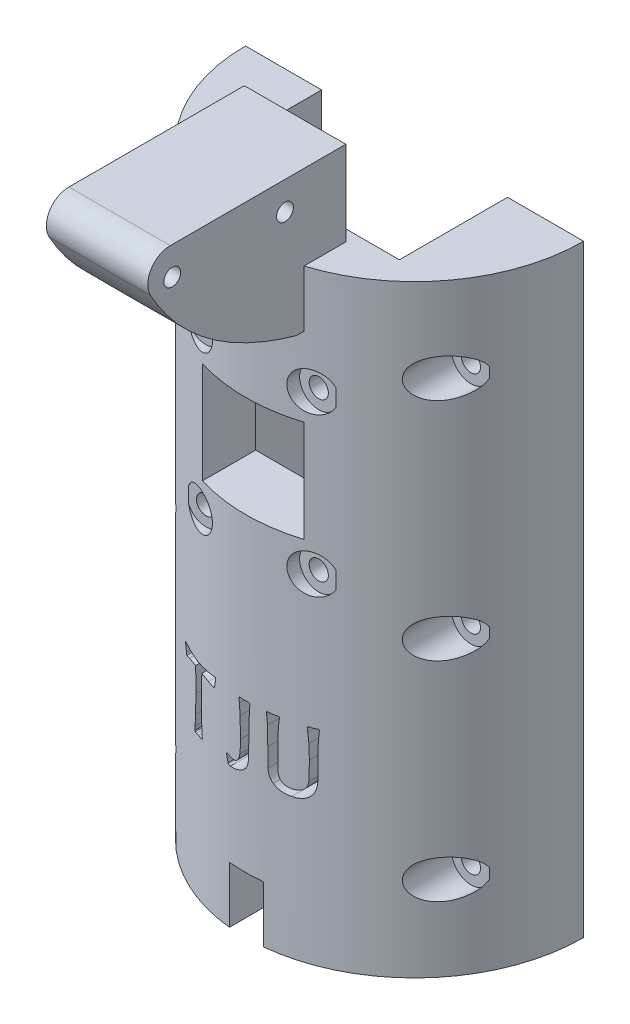
from build123d import *
from build123d.topology import SkipClean

# Parameters (mm, degrees)
EXTRUDE_1_DEPTH      = 80
SKETCH_2_R           = 1.7
CUT_EXTRUDE_1_DEPTH  = 100
SKETCH_3_R           = 1.7
CUT_EXTRUDE_2_DEPTH  = 100
SKETCH_4_R           = 3.4
CUT_EXTRUDE_3_DEPTH  = 26.5
SKETCH_5_R           = 3.4
CUT_EXTRUDE_4_DEPTH  = 13
EXTRUDE_START        = 3
EXTRUDE_2_DEPTH      = 3
EXTRUDE_4_DEPTH      = 9
SKETCH_14_R          = 1.5
CUT_EXTRUDE_6_DEPTH  = 18
SKETCH_18_W          = 18
SKETCH_18_H          = 2
CUT_EXTRUDE_9_DEPTH  = 20
SKETCH_25_W          = 18
SKETCH_25_H          = 38.8
CUT_EXTRUDE_16_DEPTH = 5
FILLET_6_R           = 4
EXTRUDE_START_2      = 19
EXTRUDE_7_DEPTH      = 19
CUT_EXTRUDE_17_REACH = 116.45
SKETCH_29_W          = 30
SKETCH_29_H          = 19.2
EXTRUDE_START_3      = 5
EXTRUDE_9_DEPTH      = 5
SKETCH_31_R          = 3
CUT_EXTRUDE_18_DEPTH = 3
FILLET_7_R           = 1
CHAMFER_3_SIZE       = 2
SKETCH_32_W          = 19.2
SKETCH_32_H          = 102
CUT_EXTRUDE_19_DEPTH = 1.5
SKETCH_33_W          = 19.2
SKETCH_33_H          = 102
CUT_EXTRUDE_20_DEPTH = 1.5
EXTRUDE_10_DEPTH     = 9.5
SKETCH_35_R          = 5
CUT_EXTRUDE_21_DEPTH = 15
SKETCH_36_W          = 6
SKETCH_36_H          = 10
CUT_EXTRUDE_22_DEPTH = 15
SKETCH_39_R          = 1.7
CUT_EXTRUDE_23_DEPTH = 115.450354124
SKETCH_40_R          = 3.4
CUT_EXTRUDE_25_DEPTH = 26.5
SKETCH_41_W          = 18
SKETCH_41_H          = 18
CUT_EXTRUDE_26_DEPTH = 108.354552922
CUT_EXTRUDE_27_DEPTH = 108.354552922


with BuildPart() as part:
    # 草图1 → 凸台-拉伸1 (new body)
    with BuildSketch(Plane(origin=(0, 0, 0), x_dir=(1, 0, 0), z_dir=(0, 1, 0))):
        with BuildLine():
            Line((-15, 0), (-30, 0))
            ThreePointArc((-30, 0), (0, -30), (30, 0))
            Line((30, 0), (15, 0))
            Line((15, 0), (15, -19.2))
            Line((15, -19.2), (-15, -19.2))
            Line((-15, -19.2), (-15, 0))
        make_face()
    extrude(amount=EXTRUDE_1_DEPTH)

    # 草图2 → 切除-拉伸1 (cut)
    with BuildSketch(Plane.XY):
        with Locations(Location((-10, 33, 0), (0, 0, 180))):
            Circle(SKETCH_2_R)
        with Locations(Location((-10, 61, 0), (0, 0, 180))):
            Circle(SKETCH_2_R)
        with Locations(Location((10, 33, 0), (0, 0, 180))):
            Circle(SKETCH_2_R)
        with Locations(Location((10, 61, 0), (0, 0, 180))):
            Circle(SKETCH_2_R)
    extrude(amount=CUT_EXTRUDE_1_DEPTH, mode=Mode.SUBTRACT)

    # 草图3 → 切除-拉伸2 (cut)
    with BuildSketch(Plane(origin=(0, 0, 0), x_dir=(-1, 0, 0), z_dir=(0, 0, -1))):
        with Locations((23.5, 65)):
            Circle(SKETCH_3_R)
        with Locations((-23.5, 65)):
            Circle(SKETCH_3_R)
        with Locations((23.5, 25)):
            Circle(SKETCH_3_R)
        with Locations((-23.5, 25)):
            Circle(SKETCH_3_R)
    extrude(amount=-CUT_EXTRUDE_2_DEPTH, mode=Mode.SUBTRACT)

    # 草图4 → 切除-拉伸3 (cut)
    with BuildSketch(Plane(origin=(0, 0, 40), x_dir=(-1, 0, 0), z_dir=(0, 0, -1))):
        with Locations((-23.5, 65)):
            Circle(SKETCH_4_R)
        with Locations((-23.5, 25)):
            Circle(SKETCH_4_R)
        with Locations((23.5, 65)):
            Circle(SKETCH_4_R)
        with Locations((23.5, 25)):
            Circle(SKETCH_4_R)
    extrude(amount=CUT_EXTRUDE_3_DEPTH, mode=Mode.SUBTRACT)

    # 草图5 → 切除-拉伸4 (cut)
    with BuildSketch(Plane(origin=(0, 0, 40), x_dir=(-1, 0, 0), z_dir=(0, 0, -1))):
        with Locations((-10, 33)):
            Circle(SKETCH_5_R)
        with Locations((10, 33)):
            Circle(SKETCH_5_R)
        with Locations((10, 61)):
            Circle(SKETCH_5_R)
        with Locations((-10, 61)):
            Circle(SKETCH_5_R)
    extrude(amount=CUT_EXTRUDE_4_DEPTH, mode=Mode.SUBTRACT)

    # 草图6 → 凸台-拉伸2 (add)
    with SkipClean():  # the faces are left unmerged after this step: merging them gives an invalid solid
        with BuildSketch(Plane.XZ.offset(EXTRUDE_START)):
            with BuildLine():
                Line((-30, 0), (30, 0))
                ThreePointArc((30, 0), (0, 30), (-30, 0))
            make_face()
        extrude(amount=-EXTRUDE_2_DEPTH)

    # 草图13 → 凸台-拉伸4 (add, symmetric)
    with SkipClean():  # the faces are left unmerged after this step: merging them gives an invalid solid
        with BuildSketch(Plane(origin=(0, 0, 0), x_dir=(0, 0, -1), z_dir=(1, 0, 0))):
            with BuildLine():
                Line((-19.2, 100), (-60, 100))
                add(Edge.make_bspline(
                    [(-60, 100), (-54.458111129, 76.859605584), (-30, 70)],
                    knots=[0, 0, 0, 1, 1, 1], degree=2))
                Line((-30, 70), (-19.2, 70))
                Line((-19.2, 70), (-19.2, 100))
            make_face()
        extrude(amount=EXTRUDE_4_DEPTH, both=True)

    # 草图14 → 切除-拉伸6 (cut)
    with SkipClean():  # the faces are left unmerged after this step: merging them gives an invalid solid
        with BuildSketch(Plane.ZY.offset(9)):
            with Locations((32, 90)):
                Circle(SKETCH_14_R)
            with Locations((52, 90)):
                Circle(SKETCH_14_R)
        extrude(amount=-CUT_EXTRUDE_6_DEPTH, mode=Mode.SUBTRACT)

    # 草图18 → 切除-拉伸9 (cut)
    with SkipClean():  # the faces are left unmerged after this step: merging them gives an invalid solid
        with BuildSketch(Plane(origin=(0, 100, 0), x_dir=(1, 0, 0), z_dir=(0, 1, 0))):
            with Locations((0, -20.2)):
                Rectangle(SKETCH_18_W, SKETCH_18_H)
        extrude(amount=-CUT_EXTRUDE_9_DEPTH, mode=Mode.SUBTRACT)

    # 草图25 → 切除-拉伸16 (cut)
    with SkipClean():  # the faces are left unmerged after this step: merging them gives an invalid solid
        with BuildSketch(Plane(origin=(0, 100, 0), x_dir=(1, 0, 0), z_dir=(0, 1, 0))):
            with Locations((0, -40.6)):
                Rectangle(SKETCH_25_W, SKETCH_25_H)
        extrude(amount=-CUT_EXTRUDE_16_DEPTH, mode=Mode.SUBTRACT)

    # 圆角6
    fillet_6_edges = [part.edges().sort_by_distance(p)[0] for p in [
        (4.4999997, 95, 58.513859135),
    ]]
    fillet(fillet_6_edges, radius=FILLET_6_R)

    # 草图28 → 凸台-拉伸7 (add)
    with SkipClean():  # the faces are left unmerged after this step: merging them gives an invalid solid
        with BuildSketch(Plane.XZ.offset(3).offset(EXTRUDE_START_2)):
            with BuildLine():
                Line((-30, 0), (30, 0))
                ThreePointArc((30, 0), (0, 30), (-30, 0))
            make_face()
        extrude(amount=-EXTRUDE_7_DEPTH)

    # 草图29 → 切除-拉伸17 (cut, up to next)
    with BuildSketch(Plane(origin=(0, 0, 0), x_dir=(1, 0, 0), z_dir=(0, 1, 0)), mode=Mode.PRIVATE) as cut_extrude_17_sk1:
        with Locations((0, -9.6)):
            Rectangle(SKETCH_29_W, SKETCH_29_H)
    cut_extrude_17_tool1 = extrude(cut_extrude_17_sk1.sketch, amount=-CUT_EXTRUDE_17_REACH, mode=Mode.PRIVATE) & part.part
    add(cut_extrude_17_tool1.solids().sort_by_distance((0, 0, 9.6))[0], mode=Mode.SUBTRACT)

    # 草图30 → 凸台-拉伸9 (add)
    with SkipClean():  # the faces are left unmerged after this step: merging them gives an invalid solid
        with BuildSketch(Plane.XZ.offset(22).offset(EXTRUDE_START_3)):
            with BuildLine():
                Line((30, 0), (-30, 0))
                ThreePointArc((-30, 0), (0, 30), (30, 0))
            make_face()
        extrude(amount=-EXTRUDE_9_DEPTH)

    # 草图31 → 切除-拉伸18 (cut)
    with SkipClean():  # the faces are left unmerged after this step: merging them gives an invalid solid
        with BuildSketch(Plane(origin=(0, -22, 0), x_dir=(1, 0, 0), z_dir=(0, 1, 0))):
            Circle(SKETCH_31_R)
        extrude(amount=-CUT_EXTRUDE_18_DEPTH, mode=Mode.SUBTRACT)

    # 圆角7
    fillet_7_edges = [part.edges().sort_by_distance(p)[0] for p in [
        (0, -25, 3),
    ]]
    fillet(fillet_7_edges, radius=FILLET_7_R)

    # 倒角3
    chamfer_3_edges = [part.edges().sort_by_distance(p)[0] for p in [
        (0, -22, 3),
    ]]
    chamfer(chamfer_3_edges, length=CHAMFER_3_SIZE - 0.0001)  # a hair under: the kernel refuses the full size

    # 草图32 → 切除-拉伸19 (cut)
    with BuildSketch(Plane.ZY.offset(-15)):
        with Locations((9.6, 29)):
            Rectangle(SKETCH_32_W, SKETCH_32_H)
    extrude(amount=-CUT_EXTRUDE_19_DEPTH, mode=Mode.SUBTRACT)

    # 草图33 → 切除-拉伸20 (cut)
    with BuildSketch(Plane(origin=(-15, 0, 0), x_dir=(0, 0, -1), z_dir=(1, 0, 0))):
        with Locations((-9.6, 29)):
            Rectangle(SKETCH_33_W, SKETCH_33_H)
    extrude(amount=-CUT_EXTRUDE_20_DEPTH, mode=Mode.SUBTRACT)

    # 草图34 → 凸台-拉伸10 (add)
    with BuildSketch(Plane.XZ.offset(27)):
        with BuildLine():
            Line((-6, 0), (6, 0))
            ThreePointArc((6, 0), (0, 6), (-6, 0))
        make_face()
    extrude(amount=EXTRUDE_10_DEPTH)

    # 草图35 → 切除-拉伸21 (cut)
    with BuildSketch(Plane.XZ.offset(27)):
        with Locations(Location((0, 18.5, 0), (0, 0, 270))):
            Circle(SKETCH_35_R)
    extrude(amount=-CUT_EXTRUDE_21_DEPTH, mode=Mode.SUBTRACT)

    # 草图36 → 切除-拉伸22 (cut)
    with BuildSketch(Plane(origin=(0, 0, 19.2), x_dir=(-1, 0, 0), z_dir=(0, 0, -1))):
        with Locations((0, -22)):
            Rectangle(SKETCH_36_W, SKETCH_36_H)
    extrude(amount=-CUT_EXTRUDE_22_DEPTH, mode=Mode.SUBTRACT)

    # 草图39 → 切除-拉伸23 (cut, through all)
    with BuildSketch(Plane(origin=(0, 0, 0), x_dir=(-1, 0, 0), z_dir=(0, 0, -1))):
        with Locations((-23.5, -12)):
            Circle(SKETCH_39_R)
        with Locations((23.5, -12)):
            Circle(SKETCH_39_R)
    extrude(amount=-CUT_EXTRUDE_23_DEPTH, mode=Mode.SUBTRACT)

    # 草图40 → 切除-拉伸25 (cut)
    with BuildSketch(Plane(origin=(0, 0, 40), x_dir=(-1, 0, 0), z_dir=(0, 0, -1))):
        with Locations((-23.5, -12)):
            Circle(SKETCH_40_R)
        with Locations((23.5, -12)):
            Circle(SKETCH_40_R)
    extrude(amount=CUT_EXTRUDE_25_DEPTH, mode=Mode.SUBTRACT)

    # 草图41 → 切除-拉伸26 (cut, through all)
    with BuildSketch(Plane(origin=(0, 0, 40), x_dir=(-1, 0, 0), z_dir=(0, 0, -1))):
        with Locations((0, 47)):
            Rectangle(SKETCH_41_W, SKETCH_41_H)
    extrude(amount=CUT_EXTRUDE_26_DEPTH, mode=Mode.SUBTRACT)

    # 草图43 → 切除-拉伸27 (cut, through all)
    with BuildSketch(Plane(origin=(0, 0, 40), x_dir=(-1, 0, 0), z_dir=(0, 0, -1))):
        with BuildLine():
            add(Edge.make_bspline(
                [(5.85703224, 9.519648867), (5.858467041, 9.502412483), (5.862384195, 9.455355368), (5.878560537, 9.366727745), (5.906137163, 9.242434203), (5.928232605, 9.147531355), (5.940631125, 9.09427807)],
                knots=[0, 0, 0, 0, 0.478148112, 1.305393878, 2.487962906, 4, 4, 4, 4], degree=3))
            add(Edge.make_bspline(
                [(5.940631125, 9.09427807), (5.973233819, 8.951255308), (6.03862516, 8.664394044), (6.076529085, 8.372624541), (6.095534941, 8.226324941)],
                knots=[0, 0, 0, 0, 0.997156331, 2, 2, 2, 2], degree=3))
            add(Edge.make_bspline(
                [(6.095534941, 8.226324941), (6.103411893, 8.181358743), (6.117783107, 8.099319538), (6.178351765, 7.991488751), (6.282121193, 7.931251708), (6.359555236, 7.924826251), (6.400424992, 7.92143489)],
                knots=[0, 0, 0, 0, 1.136989108, 2.074395553, 2.983664298, 4, 4, 4, 4], degree=3))
            add(Edge.make_bspline(
                [(6.400424992, 7.92143489), (6.408632353, 7.92216916), (6.436709982, 7.924681122), (6.494562799, 7.93619372), (6.585664468, 7.950005944), (6.709570808, 7.969681189), (6.86588075, 7.997276158), (7.055243504, 8.029038899), (7.277547265, 8.065598478), (7.436421863, 8.093394636), (7.521633567, 8.108302986)],
                knots=[0, 0, 0, 0, 0.173904883, 0.594933817, 1.243552198, 2.119766021, 3.243472513, 4.594750804, 6.173609309, 8, 8, 8, 8], degree=3))
            add(Edge.make_bspline(
                [(7.521633567, 8.108302986), (7.691956738, 8.135540926), (8.012259045, 8.186763406), (8.462916424, 8.243455806), (8.854047904, 8.267735121), (9.093606631, 8.262944537), (9.203446429, 8.260748011)],
                knots=[0, 0, 0, 0, 1.223498698, 2.300858142, 3.220928408, 4, 4, 4, 4], degree=3))
            add(Edge.make_bspline(
                [(9.203446429, 8.260748011), (9.210278891, 8.130445064), (9.22458498, 7.857611391), (9.241323622, 7.429739874), (9.255966072, 6.965833366), (9.268257485, 6.465046397), (9.277654127, 5.929016105), (9.286004197, 5.356121411), (9.286750559, 4.747953083), (9.288569611, 4.329960295), (9.289504104, 4.115226834)],
                knots=[0, 0, 0, 0, 0.755152602, 1.581169593, 2.478121407, 3.441321042, 4.480296094, 5.580853922, 6.757223506, 8, 8, 8, 8], degree=3))
            add(Edge.make_bspline(
                [(9.289504104, 4.115226834), (9.289240403, 3.807875348), (9.288729157, 3.212005666), (9.278881053, 2.346469525), (9.26176985, 1.537505505), (9.245642118, 1.017139618), (9.237869499, 0.766353854)],
                knots=[0, 0, 0, 0, 1.101138871, 2.134804283, 3.101085324, 4, 4, 4, 4], degree=3))
            add(Edge.make_bspline(
                [(9.237869499, 0.766353854), (9.229221966, 0.604051489), (9.212403119, 0.288384763), (9.181804783, -0.171296269), (9.153594949, -0.604203458), (9.130855099, -0.88352066), (9.119847544, -1.018728219)],
                knots=[0, 0, 0, 0, 1.090173847, 2.120311739, 3.090109524, 4, 4, 4, 4], degree=3))
            add(Edge.make_bspline(
                [(9.119847544, -1.018728219), (9.11561455, -1.070352287), (9.107754739, -1.166207703), (9.098748113, -1.299932398), (9.088400997, -1.412110756), (9.080729439, -1.503058729), (9.076471595, -1.572861981), (9.071762198, -1.621131294), (9.068071716, -1.648954881), (9.068188083, -1.660471512), (9.068212938, -1.662931391)],
                knots=[0, 0, 0, 0, 1.923417826, 3.571396507, 4.976677611, 6.106458477, 6.960802361, 7.572533079, 7.908695778, 8, 8, 8, 8], degree=3))
            add(Edge.make_bspline(
                [(9.068212938, -1.662931391), (9.070298477, -1.697580026), (9.074061196, -1.760092927), (9.106681231, -1.844112661), (9.174488928, -1.89496732), (9.227237146, -1.899199877), (9.255081034, -1.901434093)],
                knots=[0, 0, 0, 0, 1.20974982, 2.182624891, 3.040673024, 4, 4, 4, 4], degree=3))
            add(Edge.make_bspline(
                [(9.255081034, -1.901434093), (9.268206293, -1.900747609), (9.303573331, -1.898897826), (9.37055188, -1.889838214), (9.465066339, -1.881663859), (9.537057432, -1.872255112), (9.57718262, -1.867011022)],
                knots=[0, 0, 0, 0, 0.486650052, 1.31131663, 2.501426745, 4, 4, 4, 4], degree=3))
            add(Edge.make_bspline(
                [(9.57718262, -1.867011022), (9.663952767, -1.85636128), (9.839505839, -1.834814758), (10.016374412, -1.833335873), (10.105822628, -1.832587952)],
                knots=[0, 0, 0, 0, 0.988534648, 2, 2, 2, 2], degree=3))
            add(Edge.make_bspline(
                [(10.105822628, -1.832587952), (10.197882614, -1.834046223), (10.37472372, -1.836847465), (10.548629824, -1.868870217), (10.632003845, -1.884222557)],
                knots=[0, 0, 0, 0, 1.041160493, 2, 2, 2, 2], degree=3))
            add(Edge.make_bspline(
                [(10.632003845, -1.884222557), (10.705678618, -1.89343201), (10.82990157, -1.908960058), (10.954883157, -1.915844319), (11.005740037, -1.918645628)],
                knots=[0, 0, 0, 0, 1.186170037, 2, 2, 2, 2], degree=3))
            add(Edge.make_bspline(
                [(11.005740037, -1.918645628), (11.025750771, -1.917737699), (11.061675748, -1.916107708), (11.108288726, -1.892360211), (11.13929189, -1.851773487), (11.140388989, -1.81840339), (11.140973527, -1.800623672)],
                knots=[0, 0, 0, 0, 1.162316621, 2.086689887, 2.980580887, 4, 4, 4, 4], degree=3))
            add(Edge.make_bspline(
                [(11.140973527, -1.800623672), (11.140071683, -1.796536565), (11.136687401, -1.781199197), (11.136887373, -1.746253567), (11.126723352, -1.689294916), (11.117836822, -1.609763929), (11.108719755, -1.506245847), (11.093301569, -1.381002893), (11.076064883, -1.231842822), (11.063915694, -1.125277939), (11.057374642, -1.067904034)],
                knots=[0, 0, 0, 0, 0.135985939, 0.510303709, 1.128887405, 2.015407267, 3.114029169, 4.510020151, 6.121015412, 8, 8, 8, 8], degree=3))
            add(Edge.make_bspline(
                [(11.057374642, -1.067904034), (11.02436773, -0.764051891), (10.956233839, -0.136830882), (10.922382136, 0.493180826), (10.904929617, 0.817988459)],
                knots=[0, 0, 0, 0, 0.96888382, 2, 2, 2, 2], degree=3))
            add(Edge.make_bspline(
                [(10.904929617, 0.817988459), (10.891836627, 1.067930669), (10.865015209, 1.57994547), (10.839248059, 2.367708145), (10.820798423, 3.193911431), (10.819523939, 3.757871356), (10.818871941, 4.046380693)],
                knots=[0, 0, 0, 0, 0.929842291, 1.904812378, 2.928148678, 4, 4, 4, 4], degree=3))
            add(Edge.make_bspline(
                [(10.818871941, 4.046380693), (10.819493811, 4.29389979), (10.820688144, 4.769272238), (10.825551709, 5.452823181), (10.83290632, 6.076545161), (10.842000052, 6.639648786), (10.855859487, 7.142973485), (10.877272137, 7.586237526), (10.893994432, 7.970123569), (10.913314811, 8.2050559), (10.922141152, 8.312382617)],
                knots=[0, 0, 0, 0, 1.391782816, 2.672986505, 3.843634034, 4.899147726, 5.839693802, 6.674651578, 7.394526524, 8, 8, 8, 8], degree=3))
            add(Edge.make_bspline(
                [(10.922141152, 8.312382617), (11.085352662, 8.306777504), (11.411534895, 8.295575547), (11.898047299, 8.247012115), (12.381259635, 8.17816025), (12.698573667, 8.108636927), (12.85720946, 8.073879915)],
                knots=[0, 0, 0, 0, 1.003129854, 2.004779782, 3.002523341, 4, 4, 4, 4], degree=3))
            add(Edge.make_bspline(
                [(12.85720946, 8.073879915), (12.930961943, 8.054797382), (13.067682692, 8.019422597), (13.257139097, 7.973753388), (13.414578206, 7.933228082), (13.532472325, 7.895878387), (13.632772983, 7.874617173), (13.671080582, 7.853974104), (13.726987451, 7.842782558), (13.712269343, 7.837057071), (13.707951054, 7.835377214)],
                knots=[0, 0, 0, 0, 2.023228837, 3.750617617, 5.192897582, 6.302840761, 7.137627747, 7.668013828, 7.902595332, 8, 8, 8, 8], degree=3))
            add(Edge.make_bspline(
                [(13.707951054, 7.835377214), (13.73216587, 7.839481448), (13.782846668, 7.848071473), (13.840434118, 7.917124698), (13.877166273, 8.017313641), (13.888409436, 8.097189138), (13.894819149, 8.142726056)],
                knots=[0, 0, 0, 0, 0.732569965, 1.533244296, 2.593705774, 4, 4, 4, 4], degree=3))
            add(Edge.make_bspline(
                [(13.894819149, 8.142726056), (13.916179678, 8.29118672), (13.959339311, 8.591156242), (14.052064874, 8.879696017), (14.09889878, 9.025431929)],
                knots=[0, 0, 0, 0, 0.989838319, 2, 2, 2, 2], degree=3))
            add(Edge.make_bspline(
                [(14.09889878, 9.025431929), (14.121449471, 9.090869841), (14.160554974, 9.204346734), (14.205465313, 9.350198281), (14.238026922, 9.442580497), (14.248233684, 9.488457931), (14.251343806, 9.502437332)],
                knots=[0, 0, 0, 0, 1.657740955, 2.874714227, 3.657112006, 4, 4, 4, 4], degree=3))
            add(Edge.make_bspline(
                [(14.251343806, 9.502437332), (14.249551304, 9.52530497), (14.246086841, 9.569502447), (14.201199202, 9.624531722), (14.129771063, 9.650312813), (14.076949283, 9.653238283), (14.047264175, 9.654882357)],
                knots=[0, 0, 0, 0, 0.934583354, 1.806317963, 2.767181093, 4, 4, 4, 4], degree=3))
            add(Edge.make_bspline(
                [(14.047264175, 9.654882357), (14.028414262, 9.654058206), (13.976771919, 9.651800312), (13.876612308, 9.647621547), (13.732630648, 9.633176164), (13.544057516, 9.619329436), (13.311889902, 9.603168566), (13.036004535, 9.576401208), (12.715327964, 9.5510396), (12.486732307, 9.530530128), (12.365451313, 9.519648867)],
                knots=[0, 0, 0, 0, 0.268375882, 0.735258529, 1.42551662, 2.325865387, 3.424704897, 4.735539188, 6.268046483, 8, 8, 8, 8], degree=3))
            add(Edge.make_bspline(
                [(12.365451313, 9.519648867), (12.240075376, 9.508715989), (11.997593787, 9.487571409), (11.645030874, 9.461392495), (11.31567878, 9.435813064), (11.009113561, 9.416422385), (10.725534984, 9.401043175), (10.464824971, 9.392155806), (10.226358376, 9.383438298), (10.074685076, 9.382434137), (10.002553417, 9.381956586)],
                knots=[0, 0, 0, 0, 1.275758837, 2.467363653, 3.583779202, 4.624448483, 5.581208992, 6.462521565, 7.268817456, 8, 8, 8, 8], degree=3))
            add(Edge.make_bspline(
                [(10.002553417, 9.381956586), (9.929604422, 9.382490092), (9.775477792, 9.383617285), (9.53366064, 9.391400144), (9.26810842, 9.404073233), (8.980379078, 9.420890338), (8.669082137, 9.44440504), (8.335228863, 9.4672003), (7.978846994, 9.500377022), (7.733896819, 9.524454812), (7.607691242, 9.536860402)],
                knots=[0, 0, 0, 0, 0.72927492, 1.540811991, 2.418482048, 3.387024563, 4.422046326, 5.539381905, 6.73221677, 8, 8, 8, 8], degree=3))
            add(Edge.make_bspline(
                [(7.607691242, 9.536860402), (7.485587182, 9.547700335), (7.256973303, 9.567995803), (6.93713979, 9.593646301), (6.665331182, 9.62011389), (6.441357322, 9.636254006), (6.265865916, 9.649901771), (6.138355724, 9.664852438), (6.057790499, 9.668199043), (6.020129203, 9.671235169), (6.009477265, 9.672093892)],
                knots=[0, 0, 0, 0, 1.834207314, 3.43416304, 4.800927602, 5.920205504, 6.794019528, 7.434664168, 7.840103157, 8, 8, 8, 8], degree=3))
            add(Edge.make_bspline(
                [(6.009477265, 9.672093892), (5.987162051, 9.670356216), (5.94618554, 9.667165392), (5.889287527, 9.639838605), (5.86196074, 9.582940592), (5.858769916, 9.541964082), (5.85703224, 9.519648867)],
                knots=[0, 0, 0, 0, 1.089171063, 2, 2.910828937, 4, 4, 4, 4], degree=3))
        make_face()
        with BuildLine():
            add(Edge.make_bspline(
                [(-0.776785161, 9.177876955), (-0.776789947, 9.177057099), (-0.776838071, 9.168813133), (-0.773045128, 9.146747745), (-0.768351918, 9.104230718), (-0.764227495, 9.040130169), (-0.756801074, 8.955722985), (-0.746016033, 8.850966725), (-0.737239969, 8.725408634), (-0.729392953, 8.634472144), (-0.725150555, 8.585308388)],
                knots=[0, 0, 0, 0, 0.033067086, 0.332502286, 0.898519627, 1.760803736, 2.922395452, 4.317497343, 6.009097776, 8, 8, 8, 8], degree=3))
            add(Edge.make_bspline(
                [(-0.725150555, 8.585308388), (-0.713938706, 8.453393466), (-0.690486347, 8.177460756), (-0.665066818, 7.742049312), (-0.638873011, 7.267614175), (-0.629301954, 6.93713169), (-0.624340135, 6.765803245)],
                knots=[0, 0, 0, 0, 0.87163953, 1.823249811, 2.871531042, 4, 4, 4, 4], degree=3))
            add(Edge.make_bspline(
                [(-0.624340135, 6.765803245), (-0.619985942, 6.633855129), (-0.611062121, 6.363430441), (-0.60231242, 5.947842405), (-0.591629974, 5.513491265), (-0.584327639, 5.059420632), (-0.580278079, 4.586493188), (-0.574514459, 4.094748741), (-0.57222354, 3.584130101), (-0.572542604, 3.237438571), (-0.57270553, 3.060405609)],
                knots=[0, 0, 0, 0, 0.8549669, 1.752235381, 2.691954866, 3.668718843, 4.69317817, 5.754790134, 6.853516402, 8, 8, 8, 8], degree=3))
            add(Edge.make_bspline(
                [(-0.57270553, 3.060405609), (-0.572872379, 2.90468227), (-0.573189394, 2.608805529), (-0.571067866, 2.187518664), (-0.56538685, 1.812157447), (-0.56126684, 1.481834531), (-0.554453456, 1.196561071), (-0.54374046, 0.956486793), (-0.535702802, 0.761225955), (-0.525515052, 0.64666945), (-0.521070924, 0.596697293)],
                knots=[0, 0, 0, 0, 1.516274391, 2.880944677, 4.102048895, 5.171540464, 6.097575414, 6.880304974, 7.511563528, 8, 8, 8, 8], degree=3))
            add(Edge.make_bspline(
                [(-0.521070924, 0.596697293), (-0.511331341, 0.500693474), (-0.492628061, 0.316333808), (-0.450867438, 0.051046102), (-0.397607766, -0.192316708), (-0.331509125, -0.414381749), (-0.253678251, -0.614985564), (-0.161128801, -0.792420928), (-0.063330275, -0.952449006), (0.01765121, -1.041922416), (0.056744898, -1.085115569)],
                knots=[0, 0, 0, 0, 1.278825999, 2.45577659, 3.557476532, 4.578220771, 5.524324972, 6.403714446, 7.229395581, 8, 8, 8, 8], degree=3))
            add(Edge.make_bspline(
                [(0.056744898, -1.085115569), (0.140842744, -1.168488236), (0.309090913, -1.335285597), (0.59669309, -1.545219849), (0.907143063, -1.72500565), (1.243907269, -1.868764273), (1.603864428, -1.9856808), (1.990447393, -2.066159925), (2.401314597, -2.112038115), (2.683437069, -2.119107686), (2.827802055, -2.122725259)],
                knots=[0, 0, 0, 0, 0.932353484, 1.86528878, 2.797261652, 3.755033065, 4.745961936, 5.776130153, 6.862022799, 8, 8, 8, 8], degree=3))
            add(Edge.make_bspline(
                [(2.827802055, -2.122725259), (2.882255049, -2.120416277), (2.982698823, -2.116157138), (3.119533478, -2.072484184), (3.225414518, -1.993467225), (3.265319082, -1.920473755), (3.285137132, -1.884222557)],
                knots=[0, 0, 0, 0, 1.189903504, 2.194891271, 3.103517705, 4, 4, 4, 4], degree=3))
            add(Edge.make_bspline(
                [(3.285137132, -1.884222557), (3.307909568, -1.777636389), (3.352785285, -1.567596029), (3.39971463, -1.358005004), (3.422829413, -1.25477213)],
                knots=[0, 0, 0, 0, 1.014911304, 2, 2, 2, 2], degree=3))
            add(Edge.make_bspline(
                [(3.422829413, -1.25477213), (3.435525906, -1.208977527), (3.459270647, -1.123333327), (3.486434611, -1.002655956), (3.515488855, -0.902766582), (3.53402572, -0.820131833), (3.551016604, -0.757087493), (3.564283657, -0.713258675), (3.569625748, -0.687815204), (3.574427437, -0.67858456), (3.575274439, -0.676956307)],
                knots=[0, 0, 0, 0, 1.907736555, 3.567812814, 4.964700659, 6.08207527, 6.968114903, 7.582862527, 7.926418414, 8, 8, 8, 8], degree=3))
            add(Edge.make_bspline(
                [(3.575274439, -0.676956307), (3.57378562, -0.64687573), (3.571046259, -0.59152879), (3.528683454, -0.519801674), (3.455983627, -0.480104038), (3.401199323, -0.477022938), (3.371194808, -0.475335467)],
                knots=[0, 0, 0, 0, 1.091159656, 2.007685779, 2.908840344, 4, 4, 4, 4], degree=3))
            add(Edge.make_bspline(
                [(3.371194808, -0.475335467), (3.358040858, -0.47846823), (3.317143207, -0.488208471), (3.235696806, -0.516836312), (3.113961702, -0.567396921), (3.018007762, -0.605786831), (2.963035546, -0.627780492)],
                knots=[0, 0, 0, 0, 0.371943426, 1.156429287, 2.37091227, 4, 4, 4, 4], degree=3))
            add(Edge.make_bspline(
                [(2.963035546, -0.627780492), (2.833905723, -0.671617602), (2.580106467, -0.757777606), (2.312561564, -0.772831066), (2.181140092, -0.780225518)],
                knots=[0, 0, 0, 0, 1.017574475, 2, 2, 2, 2], degree=3))
            add(Edge.make_bspline(
                [(2.181140092, -0.780225518), (2.108425954, -0.775473863), (1.966898382, -0.766225453), (1.764390494, -0.693540277), (1.585199672, -0.572454646), (1.426836919, -0.40362186), (1.290855953, -0.189289125), (1.172027162, 0.070136816), (1.078903585, 0.376818834), (1.032702807, 0.597920629), (1.008296912, 0.714719248)],
                knots=[0, 0, 0, 0, 0.840613191, 1.63613222, 2.457448301, 3.323451566, 4.297505116, 5.384667271, 6.618431603, 8, 8, 8, 8], degree=3))
            add(Edge.make_bspline(
                [(1.008296912, 0.714719248), (0.999506677, 0.772018162), (0.980226925, 0.897692712), (0.962880659, 1.103069723), (0.945308916, 1.340730493), (0.930420322, 1.609582365), (0.921607346, 1.910474628), (0.914109478, 2.243238365), (0.909326451, 2.607975669), (0.908115424, 2.862061857), (0.907486492, 2.994018259)],
                knots=[0, 0, 0, 0, 0.609164827, 1.336090177, 2.165315449, 3.114362188, 4.165943723, 5.329241217, 6.612975697, 8, 8, 8, 8], degree=3))
            add(Edge.make_bspline(
                [(0.907486492, 2.994018259), (0.908510966, 3.328419128), (0.910489678, 3.974295004), (0.923305803, 4.908658334), (0.940970062, 5.775113619), (0.963199873, 6.329803975), (0.973873842, 6.596146684)],
                knots=[0, 0, 0, 0, 1.113740359, 2.151124882, 3.112235497, 4, 4, 4, 4], degree=3))
            add(Edge.make_bspline(
                [(0.973873842, 6.596146684), (0.982417109, 6.766649251), (0.999017191, 7.097946016), (1.030978863, 7.57992559), (1.067930137, 8.032315513), (1.095688893, 8.323884637), (1.109107332, 8.464827642)],
                knots=[0, 0, 0, 0, 1.093282708, 2.1243142, 3.09330319, 4, 4, 4, 4], degree=3))
            add(Edge.make_bspline(
                [(1.109107332, 8.464827642), (1.115198165, 8.519707102), (1.126552564, 8.622012222), (1.13728797, 8.765743092), (1.150441788, 8.887706957), (1.159898663, 8.989368039), (1.168453154, 9.070413262), (1.170798027, 9.131356431), (1.178493167, 9.170363377), (1.178078881, 9.189343143), (1.177953473, 9.19508849)],
                knots=[0, 0, 0, 0, 1.806239627, 3.36715337, 4.714482847, 5.819029443, 6.707502557, 7.379965633, 7.812309989, 8, 8, 8, 8], degree=3))
            add(Edge.make_bspline(
                [(1.177953473, 9.19508849), (1.174941645, 9.230080125), (1.169357958, 9.294951793), (1.119632594, 9.382060603), (1.027761913, 9.427478871), (0.959552728, 9.431429836), (0.922239237, 9.433591191)],
                knots=[0, 0, 0, 0, 1.05181703, 1.949983884, 2.878549027, 4, 4, 4, 4], degree=3))
            add(Edge.make_bspline(
                [(0.922239237, 9.433591191), (0.912406743, 9.432748184), (0.882909261, 9.430219164), (0.824399993, 9.426465667), (0.738817544, 9.411768533), (0.672305687, 9.403729953), (0.634560721, 9.399168121)],
                knots=[0, 0, 0, 0, 0.408640617, 1.225921851, 2.425732015, 4, 4, 4, 4], degree=3))
            add(Edge.make_bspline(
                [(0.634560721, 9.399168121), (0.551802844, 9.394466969), (0.392917778, 9.385441328), (0.233795949, 9.383085394), (0.157555318, 9.381956586)],
                knots=[0, 0, 0, 0, 1.041732601, 2, 2, 2, 2], degree=3))
            add(Edge.make_bspline(
                [(0.157555318, 9.381956586), (0.108367596, 9.383337313), (-0.01058444, 9.386676365), (-0.129327555, 9.394550191), (-0.198969338, 9.399168121)],
                knots=[0, 0, 0, 0, 0.827017747, 2, 2, 2, 2], degree=3))
            add(Edge.make_bspline(
                [(-0.198969338, 9.399168121), (-0.237476992, 9.401886108), (-0.307914813, 9.406857824), (-0.403117989, 9.410054923), (-0.477543857, 9.417352049), (-0.520241272, 9.416668486), (-0.538282459, 9.416379656)],
                knots=[0, 0, 0, 0, 1.362982669, 2.493154516, 3.363303821, 4, 4, 4, 4], degree=3))
            add(Edge.make_bspline(
                [(-0.538282459, 9.416379656), (-0.573216168, 9.414192539), (-0.637666047, 9.410157484), (-0.724029913, 9.363624408), (-0.770562988, 9.277260542), (-0.774598043, 9.212810663), (-0.776785161, 9.177876955)],
                knots=[0, 0, 0, 0, 1.084058164, 2, 2.915941836, 4, 4, 4, 4], degree=3))
        make_face()
        with BuildLine():
            add(Edge.make_bspline(
                [(-11.027483731, 9.22951156), (-11.026645807, 9.225416746), (-11.020997183, 9.197812725), (-11.012867968, 9.12546133), (-10.998413178, 8.993439935), (-10.985776502, 8.885278416), (-10.978307916, 8.821352298)],
                knots=[0, 0, 0, 0, 0.121969038, 0.82221939, 2.1218535, 4, 4, 4, 4], degree=3))
            add(Edge.make_bspline(
                [(-10.978307916, 8.821352298), (-10.967033308, 8.728801109), (-10.942826856, 8.530094796), (-10.917567497, 8.20765366), (-10.89226706, 7.841348608), (-10.880981226, 7.58133751), (-10.875038705, 7.444429487)],
                knots=[0, 0, 0, 0, 0.809958149, 1.738970615, 2.80946212, 4, 4, 4, 4], degree=3))
            add(Edge.make_bspline(
                [(-10.875038705, 7.444429487), (-10.870735862, 7.339528681), (-10.861829181, 7.122388982), (-10.852100785, 6.785511294), (-10.845703036, 6.428126609), (-10.837158814, 6.04950452), (-10.833506989, 5.651147439), (-10.82760458, 5.231532596), (-10.82539204, 4.791396427), (-10.825703396, 4.490602169), (-10.825862891, 4.336518)],
                knots=[0, 0, 0, 0, 0.810588556, 1.677879896, 2.601947894, 3.570302251, 4.601827123, 5.677644078, 6.81035534, 8, 8, 8, 8], degree=3))
            add(Edge.make_bspline(
                [(-10.825862891, 4.336518), (-10.825532815, 4.270946981), (-10.824761186, 4.117659407), (-10.832750604, 3.853809885), (-10.8318818, 3.522620024), (-10.837532974, 3.27923011), (-10.840615635, 3.146463284)],
                knots=[0, 0, 0, 0, 0.6610885, 1.545448814, 2.661066263, 4, 4, 4, 4], degree=3))
            add(Edge.make_bspline(
                [(-10.840615635, 3.146463284), (-10.843316167, 3.031723779), (-10.848408362, 2.815367964), (-10.851950233, 2.510442903), (-10.858958628, 2.245752381), (-10.858182191, 2.082629922), (-10.85782717, 2.008043175)],
                knots=[0, 0, 0, 0, 1.209606424, 2.280865536, 3.213936278, 4, 4, 4, 4], degree=3))
            add(Edge.make_bspline(
                [(-10.85782717, 2.008043175), (-10.8540845, 1.903120736), (-10.846800623, 1.698923682), (-10.830282535, 1.401225395), (-10.805585363, 1.120880151), (-10.784466165, 0.940064775), (-10.774228285, 0.85241153)],
                knots=[0, 0, 0, 0, 1.086935212, 2.115362281, 3.086390685, 4, 4, 4, 4], degree=3))
            add(Edge.make_bspline(
                [(-10.774228285, 0.85241153), (-10.756428378, 0.731590711), (-10.721787941, 0.496461053), (-10.640103257, 0.158472392), (-10.536535136, -0.155406125), (-10.413278121, -0.446524518), (-10.272115576, -0.717214388), (-10.102677849, -0.960909293), (-9.91611049, -1.183525711), (-9.707234706, -1.383086224), (-9.475028687, -1.556828527), (-9.22358245, -1.710221363), (-8.950224828, -1.839549415), (-8.654421149, -1.941098959), (-8.338651802, -2.022184394), (-8.002569369, -2.081441946), (-7.644891636, -2.115446891), (-7.399200922, -2.120254195), (-7.27291028, -2.122725259)],
                knots=[0, 0, 0, 0, 1.142897697, 2.224195684, 3.250601778, 4.233972128, 5.181389525, 6.102974854, 7.006852793, 7.896946294, 8.800856803, 9.716770585, 10.650384207, 11.625939887, 12.640228102, 13.699910597, 14.817701482, 16, 16, 16, 16], degree=3))
            add(Edge.make_bspline(
                [(-7.27291028, -2.122725259), (-7.132660583, -2.119787164), (-6.858895345, -2.114052049), (-6.460744474, -2.072633031), (-6.087054311, -2.001830686), (-5.737781667, -1.90093078), (-5.412626426, -1.770335807), (-5.11055177, -1.613533811), (-4.834518042, -1.425267304), (-4.670018961, -1.278736021), (-4.587910798, -1.205596315)],
                knots=[0, 0, 0, 0, 1.156904424, 2.258259541, 3.297883553, 4.290722296, 5.252477038, 6.183975837, 7.093548687, 8, 8, 8, 8], degree=3))
            add(Edge.make_bspline(
                [(-4.587910798, -1.205596315), (-4.525080988, -1.140395194), (-4.40055034, -1.011164537), (-4.238115498, -0.796768464), (-4.094384743, -0.571647044), (-3.976530275, -0.329997214), (-3.877140925, -0.076274131), (-3.801879901, 0.192340588), (-3.746375256, 0.474362062), (-3.728876804, 0.667771269), (-3.719957669, 0.766353854)],
                knots=[0, 0, 0, 0, 0.985184386, 1.952666232, 2.923271382, 3.889146559, 4.875260231, 5.886614393, 6.922786457, 8, 8, 8, 8], degree=3))
            add(Edge.make_bspline(
                [(-3.719957669, 0.766353854), (-3.719957669, 0.770451838), (-3.719957669, 0.787663374), (-3.719957669, 0.827004025), (-3.719957669, 0.892571778), (-3.719957669, 0.983547035), (-3.719957669, 1.100749394), (-3.719957669, 1.243359256), (-3.719957669, 1.413015817), (-3.719957669, 1.608079882), (-3.719957669, 1.829371048), (-3.719957669, 2.076069718), (-3.719957669, 2.34899549), (-3.719957669, 2.648967959), (-3.719957669, 2.974347933), (-3.719957669, 3.325955008), (-3.719957669, 3.702969587), (-3.719957669, 3.963601405), (-3.719957669, 4.098015298)],
                knots=[0, 0, 0, 0, 0.05904059, 0.24797048, 0.566789668, 1.003690037, 1.558671587, 2.255350554, 3.058302583, 4.00295203, 5.065682657, 6.246494465, 7.557195572, 8.997785978, 10.568265683, 12.24501845, 14.063468635, 16, 16, 16, 16], degree=3))
            add(Edge.make_bspline(
                [(-3.719957669, 4.098015298), (-3.720117547, 4.260295453), (-3.720430037, 4.577481559), (-3.71820324, 5.042204757), (-3.712339271, 5.485589459), (-3.708588902, 5.908530959), (-3.70020087, 6.31010631), (-3.693670451, 6.690434999), (-3.683917655, 7.049438282), (-3.675077865, 7.282156138), (-3.670781855, 7.395253673)],
                knots=[0, 0, 0, 0, 1.181007808, 2.308349223, 3.382058957, 4.408054287, 5.386426426, 6.305162331, 7.176333243, 8, 8, 8, 8], degree=3))
            add(Edge.make_bspline(
                [(-3.670781855, 7.395253673), (-3.662339868, 7.53708677), (-3.646424013, 7.804487721), (-3.615322302, 8.18132043), (-3.589133699, 8.509733521), (-3.562506656, 8.711605047), (-3.550301109, 8.804140763)],
                knots=[0, 0, 0, 0, 1.205448581, 2.2726578, 3.208205077, 4, 4, 4, 4], degree=3))
            add(Edge.make_bspline(
                [(-3.550301109, 8.804140763), (-3.545115337, 8.873282335), (-3.536486075, 8.988335772), (-3.50439462, 9.066021858), (-3.51534208, 9.19531708), (-3.499504366, 9.178753232), (-3.498666503, 9.177876955)],
                knots=[0, 0, 0, 0, 1.99118818, 3.31339078, 3.963676301, 4, 4, 4, 4], degree=3))
            add(Edge.make_bspline(
                [(-3.498666503, 9.177876955), (-3.499847584, 9.216148928), (-3.501941887, 9.284013119), (-3.543388276, 9.371476028), (-3.614181469, 9.428533358), (-3.672193755, 9.431846378), (-3.702746134, 9.433591191)],
                knots=[0, 0, 0, 0, 1.222909686, 2.168473919, 3.035420198, 4, 4, 4, 4], degree=3))
            add(Edge.make_bspline(
                [(-3.702746134, 9.433591191), (-3.725693577, 9.432805129), (-3.778171544, 9.431007502), (-3.866952445, 9.427077702), (-3.974018014, 9.41285077), (-4.051883519, 9.403948336), (-4.093693861, 9.399168121)],
                knots=[0, 0, 0, 0, 0.701725742, 1.604760063, 2.713861778, 4, 4, 4, 4], degree=3))
            add(Edge.make_bspline(
                [(-4.093693861, 9.399168121), (-4.17317368, 9.394546513), (-4.309139442, 9.38664035), (-4.445290288, 9.383331304), (-4.501853123, 9.381956586)],
                knots=[0, 0, 0, 0, 1.16911519, 2, 2, 2, 2], degree=3))
            add(Edge.make_bspline(
                [(-4.501853123, 9.381956586), (-4.561697731, 9.383249881), (-4.697864201, 9.386192559), (-4.833812698, 9.39450754), (-4.910012384, 9.399168121)],
                knots=[0, 0, 0, 0, 0.878991855, 2, 2, 2, 2], degree=3))
            add(Edge.make_bspline(
                [(-4.910012384, 9.399168121), (-4.981176312, 9.409820268), (-5.105144889, 9.428376461), (-5.230397142, 9.432033478), (-5.283748576, 9.433591191)],
                knots=[0, 0, 0, 0, 1.148096221, 2, 2, 2, 2], degree=3))
            add(Edge.make_bspline(
                [(-5.283748576, 9.433591191), (-5.318682285, 9.431404074), (-5.383132163, 9.427369019), (-5.469496029, 9.380835943), (-5.516029105, 9.294472077), (-5.52006416, 9.230022199), (-5.522251277, 9.19508849)],
                knots=[0, 0, 0, 0, 1.084058164, 2, 2.915941836, 4, 4, 4, 4], degree=3))
            add(Edge.make_bspline(
                [(-5.522251277, 9.19508849), (-5.520552438, 9.193480218), (-5.501178319, 9.175138955), (-5.511692404, 9.093128246), (-5.47399262, 8.967578753), (-5.46109639, 8.85595808), (-5.453405137, 8.789388019)],
                knots=[0, 0, 0, 0, 0.067385153, 0.768482252, 2.072737508, 4, 4, 4, 4], degree=3))
            add(Edge.make_bspline(
                [(-5.453405137, 8.789388019), (-5.442230009, 8.696827449), (-5.417934964, 8.495598135), (-5.390655931, 8.169872773), (-5.359886029, 7.797920338), (-5.343864093, 7.534624425), (-5.335383181, 7.395253673)],
                knots=[0, 0, 0, 0, 0.799451053, 1.738029355, 2.802668269, 4, 4, 4, 4], degree=3))
            add(Edge.make_bspline(
                [(-5.335383181, 7.395253673), (-5.329157002, 7.287088495), (-5.316285289, 7.06347284), (-5.306057728, 6.71661717), (-5.292594476, 6.348683986), (-5.283232001, 5.959347717), (-5.275589133, 5.54954388), (-5.271812936, 5.118410785), (-5.265113774, 4.666012919), (-5.266055137, 4.357010649), (-5.266537041, 4.198825719)],
                knots=[0, 0, 0, 0, 0.81316305, 1.681095444, 2.604360286, 3.576637515, 4.604134208, 5.680748912, 6.812725318, 8, 8, 8, 8], degree=3))
            add(Edge.make_bspline(
                [(-5.266537041, 4.198825719), (-5.266372398, 3.980813), (-5.266059205, 3.56609537), (-5.268153902, 2.976795023), (-5.27385163, 2.453082557), (-5.277949177, 1.995729601), (-5.284719349, 1.603919623), (-5.29550939, 1.277774643), (-5.303283201, 1.016977215), (-5.313714089, 0.865506661), (-5.318171646, 0.800776924)],
                knots=[0, 0, 0, 0, 1.539414017, 2.928371051, 4.161114057, 5.237608642, 6.157948465, 6.928003501, 7.541890819, 8, 8, 8, 8], degree=3))
            add(Edge.make_bspline(
                [(-5.318171646, 0.800776924), (-5.334044223, 0.675993044), (-5.364873301, 0.433627097), (-5.486786552, 0.095015408), (-5.659013316, -0.208977688), (-5.816867892, -0.374940407), (-5.895987469, -0.458123932)],
                knots=[0, 0, 0, 0, 1.063245602, 2.065126724, 3.030206423, 4, 4, 4, 4], degree=3))
            add(Edge.make_bspline(
                [(-5.895987469, -0.458123932), (-5.939308614, -0.496246046), (-6.026732937, -0.573178454), (-6.176119047, -0.666520119), (-6.333091038, -0.752550548), (-6.504709051, -0.817938326), (-6.688108467, -0.870194223), (-6.884120122, -0.905910247), (-7.092057066, -0.928786653), (-7.234325752, -0.931353383), (-7.30733335, -0.932670543)],
                knots=[0, 0, 0, 0, 0.90660765, 1.829581381, 2.764285833, 3.719934206, 4.712050854, 5.761846806, 6.851453596, 8, 8, 8, 8], degree=3))
            add(Edge.make_bspline(
                [(-7.30733335, -0.932670543), (-7.393430423, -0.931267715), (-7.56100624, -0.928537308), (-7.805273821, -0.907006553), (-8.034425319, -0.867241892), (-8.248558912, -0.814143581), (-8.44746402, -0.744334803), (-8.632210563, -0.661192946), (-8.80355596, -0.562665218), (-8.958856644, -0.447187064), (-9.097314094, -0.314424387), (-9.224028917, -0.170322305), (-9.331582343, -0.007638554), (-9.429473749, 0.166921975), (-9.506940226, 0.360054741), (-9.569949732, 0.567679428), (-9.623564546, 0.788977187), (-9.643043722, 0.943123968), (-9.65301971, 1.02206809)],
                knots=[0, 0, 0, 0, 1.208882527, 2.352919435, 3.438931306, 4.471684294, 5.44712477, 6.394810809, 7.312678976, 8.21724769, 9.104594802, 10.002107948, 10.905431253, 11.837688405, 12.807955538, 13.819915973, 14.883500405, 16, 16, 16, 16], degree=3))
            add(Edge.make_bspline(
                [(-9.65301971, 1.02206809), (-9.658159004, 1.081060973), (-9.670424343, 1.221852233), (-9.685147806, 1.46692941), (-9.692660567, 1.779372564), (-9.703629595, 2.157977294), (-9.710432646, 2.603053201), (-9.714383597, 3.115317593), (-9.720905034, 3.694760481), (-9.719924072, 4.10375034), (-9.71940706, 4.319306464)],
                knots=[0, 0, 0, 0, 0.430830369, 1.02821134, 1.78589877, 2.704523701, 3.783990473, 5.024369655, 6.431708436, 8, 8, 8, 8], degree=3))
            add(Edge.make_bspline(
                [(-9.71940706, 4.319306464), (-9.716599522, 4.757047961), (-9.711114051, 5.612323539), (-9.672077051, 6.466720196), (-9.65301971, 6.8838252)],
                knots=[0, 0, 0, 0, 1.023626787, 2, 2, 2, 2], degree=3))
            add(Edge.make_bspline(
                [(-9.65301971, 6.8838252), (-9.634312332, 7.161916377), (-9.597607155, 7.707550584), (-9.530849463, 8.250322632), (-9.498115894, 8.516462247)],
                knots=[0, 0, 0, 0, 1.019331903, 2, 2, 2, 2], degree=3))
            add(Edge.make_bspline(
                [(-9.498115894, 8.516462247), (-9.493557031, 8.568133198), (-9.485084235, 8.664165358), (-9.468108758, 8.797372813), (-9.460152246, 8.910000523), (-9.449866929, 9.001680867), (-9.441176448, 9.072009228), (-9.439645751, 9.121692742), (-9.431415597, 9.149013796), (-9.431673898, 9.160660275), (-9.431728544, 9.163124211)],
                knots=[0, 0, 0, 0, 1.914528308, 3.55821375, 4.955077774, 6.080940441, 6.962943304, 7.571009996, 7.909242654, 8, 8, 8, 8], degree=3))
            add(Edge.make_bspline(
                [(-9.431728544, 9.163124211), (-9.433364562, 9.203097954), (-9.436363929, 9.27638315), (-9.487808249, 9.371751669), (-9.578468794, 9.426456319), (-9.647327627, 9.431068797), (-9.68498399, 9.433591191)],
                knots=[0, 0, 0, 0, 1.125215119, 2.062894385, 2.940668208, 4, 4, 4, 4], degree=3))
            add(Edge.make_bspline(
                [(-9.68498399, 9.433591191), (-9.706354335, 9.431496089), (-9.769526942, 9.425302783), (-9.831104977, 9.409575259), (-9.871852086, 9.399168121)],
                knots=[0, 0, 0, 0, 0.676570014, 2, 2, 2, 2], degree=3))
            add(Edge.make_bspline(
                [(-9.871852086, 9.399168121), (-9.927553875, 9.394448605), (-10.046997811, 9.384328328), (-10.166866639, 9.382781867), (-10.230835533, 9.381956586)],
                knots=[0, 0, 0, 0, 0.932685083, 2, 2, 2, 2], degree=3))
            add(Edge.make_bspline(
                [(-10.230835533, 9.381956586), (-10.283318995, 9.383042816), (-10.39087198, 9.385268798), (-10.49805634, 9.394461336), (-10.552937119, 9.399168121)],
                knots=[0, 0, 0, 0, 0.975955459, 2, 2, 2, 2], degree=3))
            add(Edge.make_bspline(
                [(-10.552937119, 9.399168121), (-10.601085195, 9.409756724), (-10.679813441, 9.427070441), (-10.760211176, 9.431766943), (-10.79143982, 9.433591191)],
                knots=[0, 0, 0, 0, 1.223146168, 2, 2, 2, 2], degree=3))
            add(Edge.make_bspline(
                [(-10.79143982, 9.433591191), (-10.826379656, 9.432219247), (-10.889405796, 9.429744469), (-10.971419255, 9.388604143), (-11.021471321, 9.316392265), (-11.025386226, 9.259820981), (-11.027483731, 9.22951156)],
                knots=[0, 0, 0, 0, 1.171521003, 2.113245409, 2.989126012, 4, 4, 4, 4], degree=3))
        make_face()
    extrude(amount=CUT_EXTRUDE_27_DEPTH, mode=Mode.SUBTRACT)


solid = part.part
